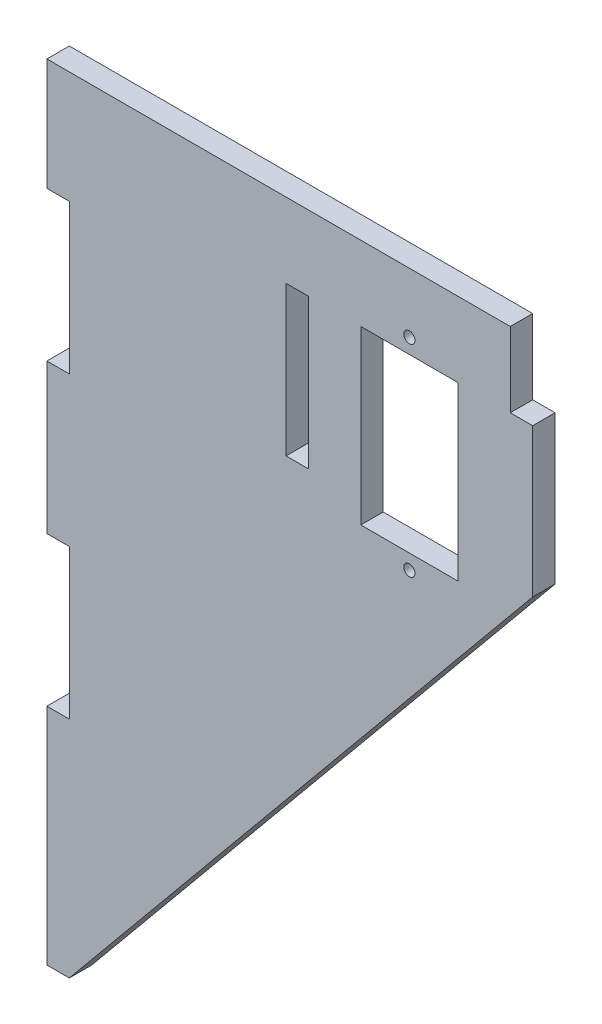
from build123d import *

# Parameters (mm, degrees)
SKETCH1_R           = 0.75
SKETCH1_W           = 13
SKETCH1_H           = 23
SKETCH1_W_2         = 3
SKETCH1_H_2         = 20
BOSS_EXTRUDE1_DEPTH = 3


with BuildPart() as part:
    # Sketch1 → Boss-Extrude1 (new body)
    with BuildSketch(Plane.XY):
        Polygon((-3, 70), (-3, 50), (0, 50), (0, 30), (-3, 30), (-3, 0), (0, 0), (62, 75.151515152), (62, 95), (59, 95), (59, 105), (15, 105), (-3, 105), (-3, 90), (0, 90), (0, 70), align=None)
        with Locations((45.5, 97)):
            Circle(SKETCH1_R, mode=Mode.SUBTRACT)
        with Locations((45.5, 70)):
            Circle(SKETCH1_R, mode=Mode.SUBTRACT)
        with Locations((45.5, 83.5)):
            Rectangle(SKETCH1_W, SKETCH1_H, mode=Mode.SUBTRACT)
        with Locations((30.5, 85)):
            Rectangle(SKETCH1_W_2, SKETCH1_H_2, mode=Mode.SUBTRACT)
    extrude(amount=BOSS_EXTRUDE1_DEPTH)


solid = part.part
